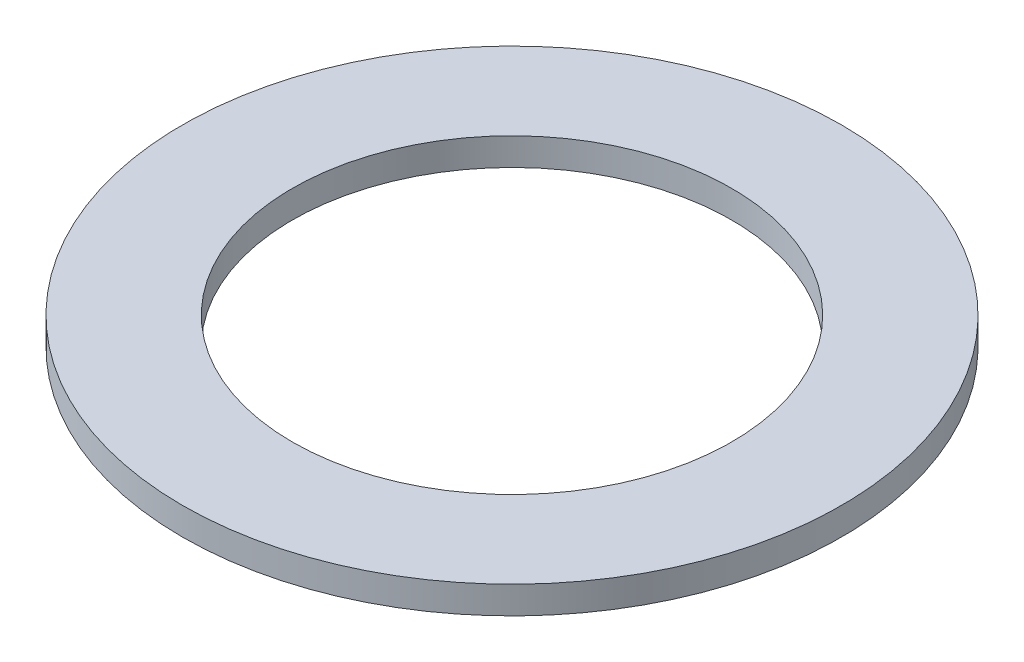
from build123d import *

# Parameters (mm, degrees)
SKETCH1_R           = 60
BOSS_EXTRUDE1_DEPTH = 5
SKETCH2_R           = 40
CUT_EXTRUDE1_DEPTH  = 86


with BuildPart() as part:
    # Sketch1 → Boss-Extrude1 (new body)
    with BuildSketch(Plane(origin=(0, 0, 0), x_dir=(1, 0, 0), z_dir=(0, 1, 0))):
        Circle(SKETCH1_R)
    extrude(amount=BOSS_EXTRUDE1_DEPTH)

    # Sketch2 → Cut-Extrude1 (cut, through all)
    with BuildSketch(Plane(origin=(0, 0, 0), x_dir=(1, 0, 0), z_dir=(0, 1, 0))):
        Circle(SKETCH2_R)
    extrude(amount=CUT_EXTRUDE1_DEPTH, mode=Mode.SUBTRACT)


solid = part.part
